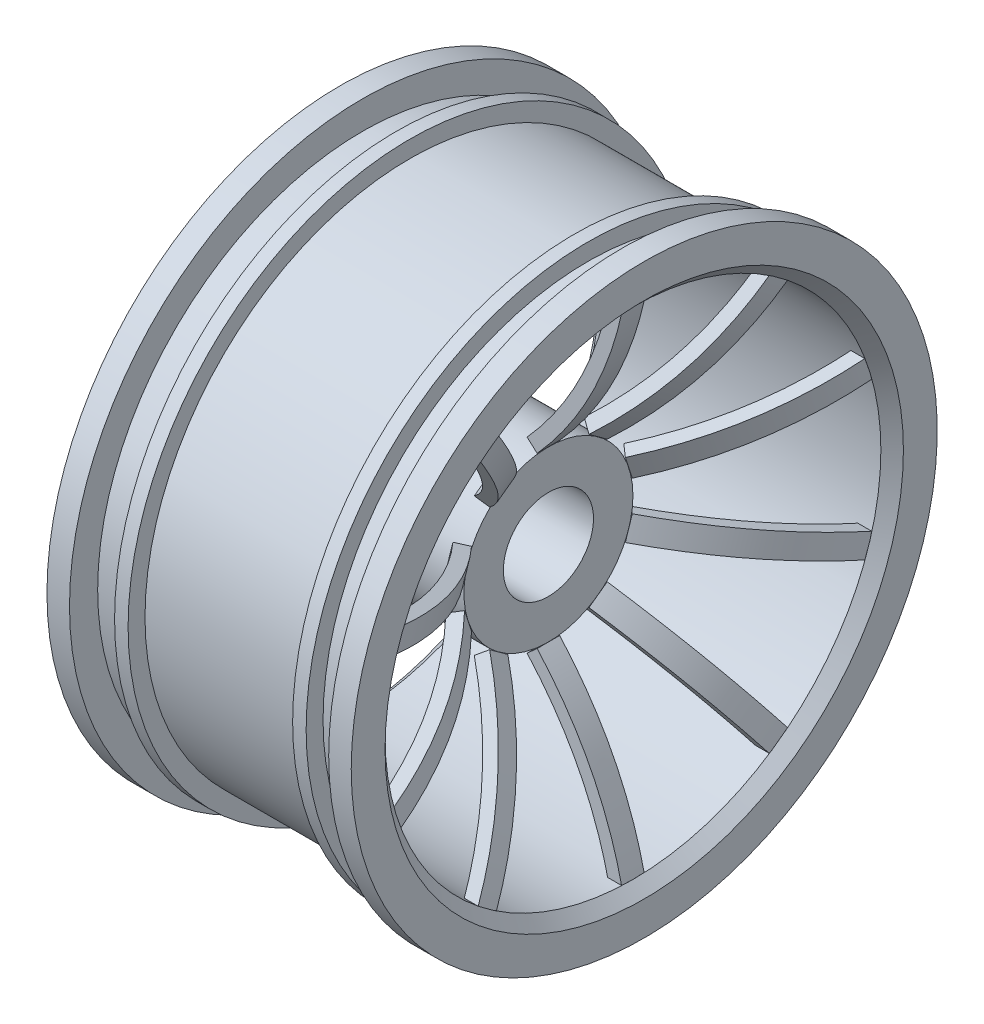
from build123d import *

# Parameters (mm, degrees)
CHAMFER1_SIZE       = 1
SKETCH2_R           = 7.5
SKETCH2_R_2         = 4
BOSS_EXTRUDE1_DEPTH = 5
EXTRUDE_THIN2_START = -1
EXTRUDE_THIN2_DEPTH = 2
CIRPATTERN1_COUNT   = 10


# Read off the part's stored shape, not the designer's step: Extrude-Thin2
with BuildPart() as part:
    # Sketch1 → Revolve1 (revolve)
    with BuildSketch(Plane.XY, mode=Mode.PRIVATE) as revolve1_sk:
        Polygon((-13.5, 22), (13.5, 22), (13.5, 26), (11.5, 26), (11.5, 23.5), (8.5, 23.5), (8.5, 25), (7.3, 25), (7.3, 23.5), (-7.3, 23.5), (-7.3, 25), (-8.5, 25), (-8.5, 23.5), (-11.5, 23.5), (-11.5, 26), (-13.5, 26), align=None)
    revolve(revolve1_sk.sketch.rotate(Axis((-13.5, 0, 0), (1, 0, 0)), 90), axis=Axis((-13.5, 0, 0), (1, 0, 0)))

    # Chamfer1
    chamfer1_edges = [part.edges().sort_by_distance(p)[0] for p in [
        (-13.5, 0, -22),
        (13.5, 0, -22),
    ]]
    chamfer(chamfer1_edges, length=CHAMFER1_SIZE)


with BuildPart() as body_2:
    # Sketch2 → Boss-Extrude1 (new, symmetric)
    with BuildSketch(Plane(origin=(0, 0, 0), x_dir=(0, 0, -1), z_dir=(1, 0, 0))):
        Circle(SKETCH2_R)
        Circle(SKETCH2_R_2, mode=Mode.SUBTRACT)
    extrude(amount=BOSS_EXTRUDE1_DEPTH, both=True)


with BuildPart() as body_3:
    # Extrude-Thin2 outline → Extrude-Thin2 (new body)
    with BuildSketch(Plane.XY.offset(EXTRUDE_THIN2_START)):
        with BuildLine():
            Line((4.106479489, 8.301012544), (5, 7.5))
            add(Edge.make_bspline(
                [(5, 7.5), (10.666887119, 13.821349036), (12.5, 22)],
                knots=[0, 0, 0, 1, 1, 1], degree=2))
            Line((12.5, 22), (11.329051499, 22.262449246))
            add(Edge.make_bspline(
                [(4.106479489, 8.301012544), (5.931055828, 10.336306991), (7.44052062, 12.512995937), (9.844644155, 17.160968105), (10.739657019, 19.632795732), (11.329051499, 22.262449246)],
                knots=[0, 0, 0, 0, 0.5, 0.5, 1, 1, 1, 1], degree=3))
        make_face()
    extrude(amount=EXTRUDE_THIN2_DEPTH)


with BuildPart() as cirpattern1_1:
    # CirPattern1: pattern copy
    add(body_3.part.rotate(Axis((5, 0, 0), (1, 0, 0)), 1 * 360 / CIRPATTERN1_COUNT))


with BuildPart() as cirpattern1_2:
    # CirPattern1: pattern copy
    add(body_3.part.rotate(Axis((5, 0, 0), (1, 0, 0)), 2 * 360 / CIRPATTERN1_COUNT))


with BuildPart() as cirpattern1_3:
    # CirPattern1: pattern copy
    add(body_3.part.rotate(Axis((5, 0, 0), (1, 0, 0)), 3 * 360 / CIRPATTERN1_COUNT))


with BuildPart() as cirpattern1_4:
    # CirPattern1: pattern copy
    add(body_3.part.rotate(Axis((5, 0, 0), (1, 0, 0)), 4 * 360 / CIRPATTERN1_COUNT))


with BuildPart() as cirpattern1_5:
    # CirPattern1: pattern copy
    add(body_3.part.rotate(Axis((5, 0, 0), (1, 0, 0)), 5 * 360 / CIRPATTERN1_COUNT))


with BuildPart() as cirpattern1_6:
    # CirPattern1: pattern copy
    add(body_3.part.rotate(Axis((5, 0, 0), (1, 0, 0)), 6 * 360 / CIRPATTERN1_COUNT))


with BuildPart() as cirpattern1_7:
    # CirPattern1: pattern copy
    add(body_3.part.rotate(Axis((5, 0, 0), (1, 0, 0)), 7 * 360 / CIRPATTERN1_COUNT))


with BuildPart() as cirpattern1_8:
    # CirPattern1: pattern copy
    add(body_3.part.rotate(Axis((5, 0, 0), (1, 0, 0)), 8 * 360 / CIRPATTERN1_COUNT))


with BuildPart() as cirpattern1_9:
    # CirPattern1: pattern copy
    add(body_3.part.rotate(Axis((5, 0, 0), (1, 0, 0)), 9 * 360 / CIRPATTERN1_COUNT))


solid = Compound([part.part, body_2.part, body_3.part, cirpattern1_1.part, cirpattern1_2.part, cirpattern1_3.part, cirpattern1_4.part, cirpattern1_5.part, cirpattern1_6.part, cirpattern1_7.part, cirpattern1_8.part, cirpattern1_9.part])
